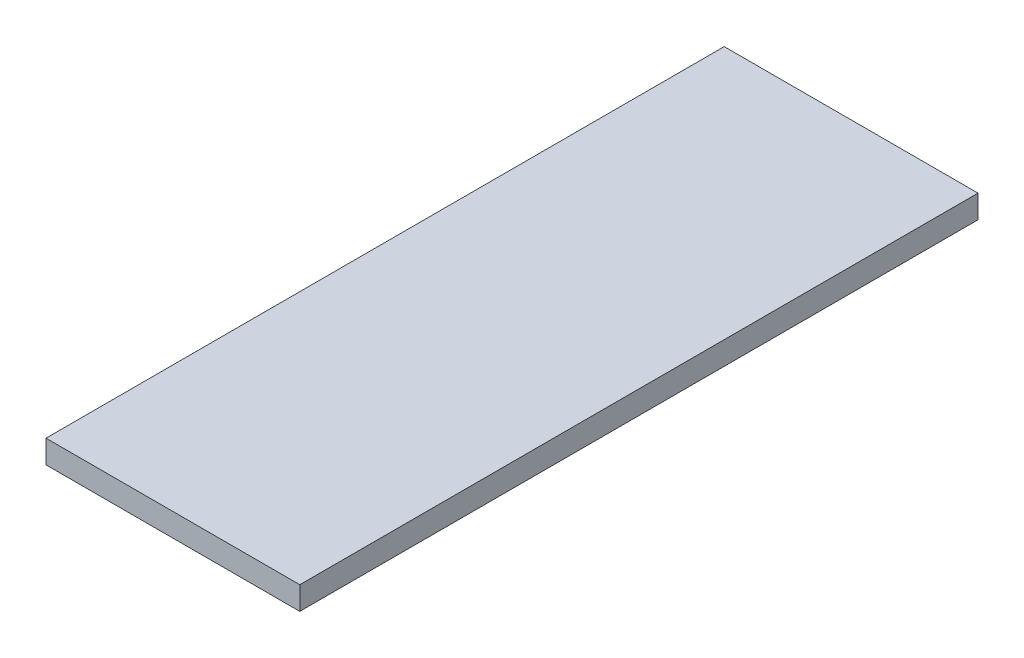
from build123d import *

# Parameters (mm, degrees)
SKETCH1_W           = 209.098719395
SKETCH1_H           = 19.05
BOSS_EXTRUDE1_DEPTH = 558.8


with BuildPart() as part:
    # Sketch1 → Boss-Extrude1 (new body)
    with BuildSketch(Plane.XY):
        with Locations((-632.635138553, 1853.471787186)):
            Rectangle(SKETCH1_W, SKETCH1_H)
    extrude(amount=BOSS_EXTRUDE1_DEPTH)


solid = part.part
